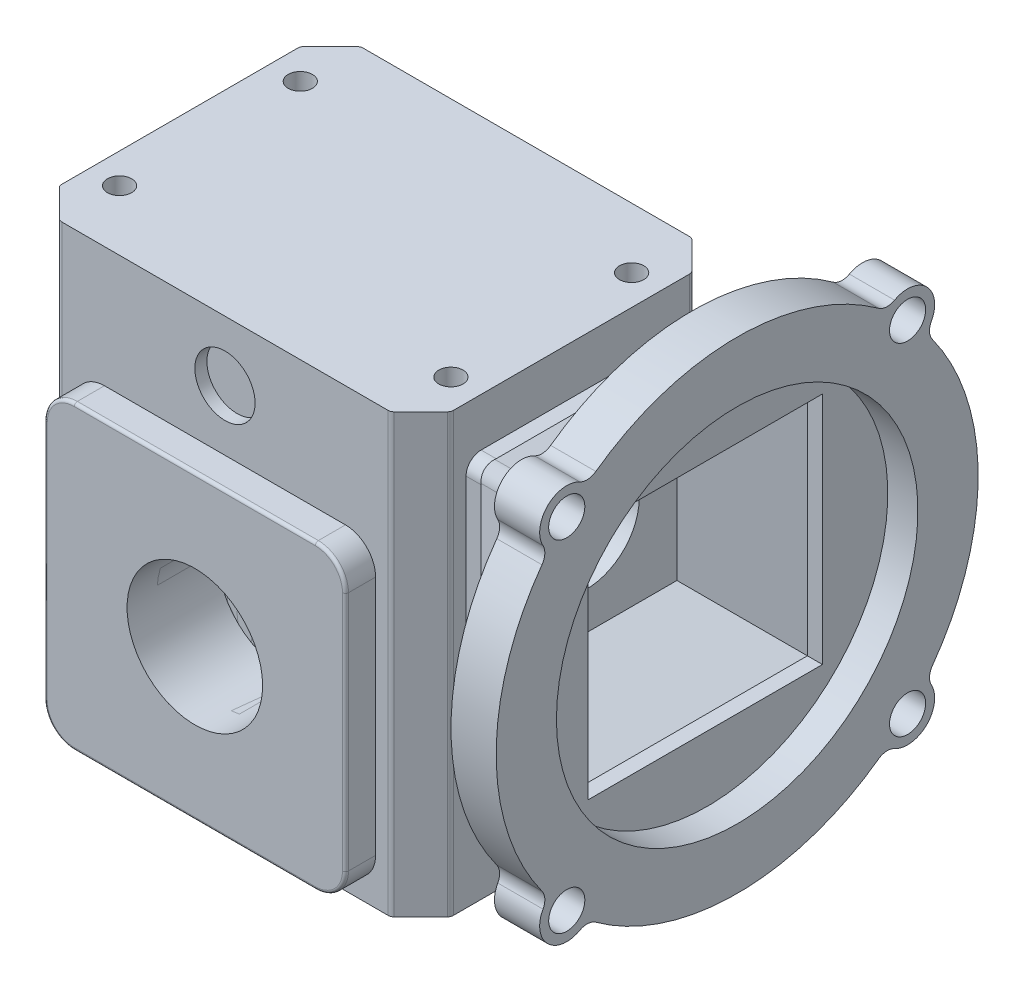
from build123d import *

# Parameters (mm, degrees)
SKETCH1_W                            = 82.55
SKETCH1_H                            = 63.5
BOSS_EXTRUDE1_DEPTH                  = 46.101
CHAMFER1_SIZE                        = 6.35
BOSS_EXTRUDE2_DEPTH                  = 6.35
BOSS_EXTRUDE2_DEPTH_BACK             = 69.85
SKETCH2_W                            = 63.5
SKETCH2_H                            = 63.5
FILLET1_R                            = 6.35
FILLET2_R                            = 0.635
FILLET3_R                            = 1.27
SKETCH3_R                            = 14.2875
CUT_EXTRUDE1_DEPTH                   = 19.05
SKETCH4_W                            = 44.45
SKETCH4_H                            = 44.45
BOSS_EXTRUDE3_DEPTH                  = 3.175
FILLET4_R                            = 3.175
SKETCH7_R                            = 38.1
SKETCH7_W                            = 49.391408666
SKETCH7_H                            = 49.391408666
BOSS_EXTRUDE4_DEPTH                  = 3.175
SKETCH8_R                            = 50.8
SKETCH8_R_2                          = 38.1
BOSS_EXTRUDE5_DEPTH                  = 9.525
SKETCH12_R                           = 5.715
SKETCH12_R_2                         = 3.81
BOSS_EXTRUDE6_DEPTH                  = 9.525
SKETCH13_R                           = 3.81
CUT_EXTRUDE2_DEPTH                   = 9.525
FILLET5_R                            = 3.175
SKETCH14_R                           = 11.1125
CUT_EXTRUDE3_DEPTH                   = 6.35
TAP_DRILL_FOR_1_4_20_TAP1_AT_2_COUNT = 2
TAP_DRILL_FOR_1_4_20_TAP1_AT_2_PITCH = 38.1
TAP_DRILL_FOR_1_4_20_TAP1_AT_3_COUNT = 2
TAP_DRILL_FOR_1_4_20_TAP1_AT_3_PITCH = 69.85
TAP_DRILL_FOR_1_4_20_TAP1_AT_4_COUNT = 2
TAP_DRILL_FOR_1_4_20_TAP1_AT_4_PITCH = 79.565271947
SKETCH18_R                           = 6.35
CUT_EXTRUDE4_DEPTH                   = 2.54
SKETCH19_R                           = 3.175
CUT_EXTRUDE5_DEPTH                   = 12.7


with BuildPart() as part:
    # Sketch1 → Boss-Extrude1 (new, symmetric)
    with BuildSketch(Plane(origin=(0, 0, 0), x_dir=(1, 0, 0), z_dir=(0, 1, 0))):
        Rectangle(SKETCH1_W, SKETCH1_H)
    extrude(amount=BOSS_EXTRUDE1_DEPTH, both=True)

    # Chamfer1
    chamfer1_edges = [part.edges().sort_by_distance(p)[0] for p in [
        (41.275, 0, -31.75),
        (-41.275, 0, -31.75),
        (-41.275, 0, 31.75),
        (41.275, 0, 31.75),
    ]]
    chamfer(chamfer1_edges, length=CHAMFER1_SIZE)

    # Fillet3
    fillet3_edges = [part.edges().sort_by_distance(p)[0] for p in [
        (34.925, 0, 31.75),
        (41.275, 0, 25.4),
        (41.275, 0, -25.4),
        (34.925, 0, -31.75),
        (-34.925, 0, -31.75),
        (-41.275, 0, -25.4),
        (-41.275, 0, 25.4),
        (-34.925, 0, 31.75),
    ]]
    fillet(fillet3_edges, radius=FILLET3_R)


with BuildPart() as body_2:
    # Sketch2 → Boss-Extrude2 (new, two sides: drawn at the far end of the back side and taken through both)
    with BuildSketch(Plane.XY.offset(31.75).offset(-BOSS_EXTRUDE2_DEPTH_BACK)):
        with Locations((0, -11.049)):
            Rectangle(SKETCH2_W, SKETCH2_H)
    extrude(amount=BOSS_EXTRUDE2_DEPTH + BOSS_EXTRUDE2_DEPTH_BACK)

    # Fillet1
    fillet1_edges = [body_2.edges().sort_by_distance(p)[0] for p in [
        (-31.75, -42.799, 0),
        (31.75, -42.799, 0),
        (31.75, 20.701, 0),
        (-31.75, 20.701, 0),
    ]]
    fillet(fillet1_edges, radius=FILLET1_R)

    # Fillet2
    fillet2_edges = [body_2.edges().sort_by_distance(p)[0] for p in [
        (-29.890128061, 18.841128061, -38.1),
        (0, 20.701, -38.1),
        (29.890128061, 18.841128061, -38.1),
        (31.75, -11.049, -38.1),
        (29.890128061, -40.939128061, -38.1),
        (0, -42.799, -38.1),
        (-29.890128061, -40.939128061, -38.1),
        (29.890128061, 18.841128061, 38.1),
        (31.75, -11.049, 38.1),
        (29.890128061, -40.939128061, 38.1),
        (0, -42.799, 38.1),
        (-29.890128061, -40.939128061, 38.1),
        (-31.75, -11.049, 38.1),
        (-29.890128061, 18.841128061, 38.1),
        (-31.75, -11.049, -38.1),
        (0, 20.701, 38.1),
    ]]
    fillet(fillet2_edges, radius=FILLET2_R)


with BuildPart() as cut_extrude1_tool:
    # Sketch3 → Cut-Extrude1 (new body)
    with BuildSketch(Plane.XY.offset(38.1)):
        with Locations((0, -11.049)):
            Circle(SKETCH3_R)
    extrude(amount=-CUT_EXTRUDE1_DEPTH)


with BuildPart() as part_1:
    add(part.part)

    # Cut-Extrude1: cut by cut_extrude1_tool
    add(cut_extrude1_tool.part, mode=Mode.SUBTRACT)

    # Sketch4 → Boss-Extrude3 (add)
    with BuildSketch(Plane(origin=(41.275, 0, 0), x_dir=(0, 0, -1), z_dir=(1, 0, 0))):
        with Locations((0.018051224, 13.716)):
            Rectangle(SKETCH4_W, SKETCH4_H)
    extrude(amount=BOSS_EXTRUDE3_DEPTH)

    # Sweep1: sweep along a path in Sketch6
    with BuildLine(Plane(origin=(44.45, 0, 0), x_dir=(0, 0, -1), z_dir=(1, 0, 0))) as sweep1_path:
        Line((-22.206948776, 35.941), (22.243051224, 35.941))
        Line((22.243051224, 35.941), (22.243051224, -8.509))
        Line((22.243051224, -8.509), (-22.206948776, -8.509))
        Line((-22.206948776, -8.509), (-22.206948776, 35.941))
    # Sketch5 → Sweep1 (sweep)
    with BuildSketch(Plane.XY):
        Polygon((44.45, 35.941), (66.675, 45.466), (66.675, 42.291), (44.45, 32.766), align=None)
    sweep(path=sweep1_path.line, transition=Transition.RIGHT)

    # Fillet4
    fillet4_edges = [part_1.edges().sort_by_distance(p)[0] for p in [
        (42.8625, -8.509, 22.206948776),
    ]]
    fillet(fillet4_edges, radius=FILLET4_R)
    fillet4_2_edges = [part_1.edges().sort_by_distance(p)[0] for p in [
        (42.8625, 35.941, 22.206948776),
    ]]
    fillet(fillet4_2_edges, radius=FILLET4_R)
    fillet4_3_edges = [part_1.edges().sort_by_distance(p)[0] for p in [
        (42.8625, -8.509, -22.243051224),
    ]]
    fillet(fillet4_3_edges, radius=FILLET4_R)
    fillet4_4_edges = [part_1.edges().sort_by_distance(p)[0] for p in [
        (42.8625, 35.941, -22.243051224),
    ]]
    fillet(fillet4_4_edges, radius=FILLET4_R)
    fillet4_5_edges = [part_1.edges().sort_by_distance(p)[0] for p in [
        (54.477574702, -12.806532015, 26.504480791),
    ]]
    fillet(fillet4_5_edges, radius=FILLET4_R)
    fillet4_6_edges = [part_1.edges().sort_by_distance(p)[0] for p in [
        (54.477574702, 40.238532015, 26.504480791),
    ]]
    fillet(fillet4_6_edges, radius=FILLET4_R)
    fillet4_7_edges = [part_1.edges().sort_by_distance(p)[0] for p in [
        (54.477574702, -12.806532015, -26.540583239),
    ]]
    fillet(fillet4_7_edges, radius=FILLET4_R)
    fillet4_8_edges = [part_1.edges().sort_by_distance(p)[0] for p in [
        (54.477574702, 40.238532015, -26.540583239),
    ]]
    fillet(fillet4_8_edges, radius=FILLET4_R)

    # Sketch7 → Boss-Extrude4 (add)
    with BuildSketch(Plane(origin=(66.675, 0, 0), x_dir=(0, 0, -1), z_dir=(1, 0, 0))):
        with Locations((0.018051224, 13.716)):
            Circle(SKETCH7_R)
        with Locations((-0.349703585, 14.083754809)):
            Rectangle(SKETCH7_W, SKETCH7_H, mode=Mode.SUBTRACT)
    extrude(amount=BOSS_EXTRUDE4_DEPTH)

    # Sketch8 → Boss-Extrude5 (add)
    with BuildSketch(Plane(origin=(66.675, 0, 0), x_dir=(0, 0, -1), z_dir=(1, 0, 0))):
        with Locations((0.018051224, 13.716)):
            Circle(SKETCH8_R)
        with Locations((0.018051224, 13.716)):
            Circle(SKETCH8_R_2, mode=Mode.SUBTRACT)
    extrude(amount=BOSS_EXTRUDE5_DEPTH)

    # Sketch12 → Boss-Extrude6 (add)
    # profile 1 of 4: a face of its own
    with BuildSketch(Plane(origin=(76.2, 0, 0), x_dir=(0, 0, -1), z_dir=(1, 0, 0))):
        with Locations((-35.90297326, 49.637024484)):
            Circle(SKETCH12_R)
        with Locations((-35.90297326, 49.637024484)):
            Circle(SKETCH12_R_2, mode=Mode.SUBTRACT)
    # profile 2 of 4: a face of its own
    with BuildSketch(Plane(origin=(76.2, 0, 0), x_dir=(0, 0, -1), z_dir=(1, 0, 0))):
        with Locations((-35.90297326, -22.205024484)):
            Circle(SKETCH12_R)
        with Locations((-35.90297326, -22.205024484)):
            Circle(SKETCH12_R_2, mode=Mode.SUBTRACT)
    # profile 3 of 4: a face of its own
    with BuildSketch(Plane(origin=(76.2, 0, 0), x_dir=(0, 0, -1), z_dir=(1, 0, 0))):
        with Locations((35.939075708, -22.205024484)):
            Circle(SKETCH12_R)
        with Locations((35.939075708, -22.205024484)):
            Circle(SKETCH12_R_2, mode=Mode.SUBTRACT)
    # profile 4 of 4: a face of its own
    with BuildSketch(Plane(origin=(76.2, 0, 0), x_dir=(0, 0, -1), z_dir=(1, 0, 0))):
        with Locations((35.939075708, 49.637024484)):
            Circle(SKETCH12_R)
        with Locations((35.939075708, 49.637024484)):
            Circle(SKETCH12_R_2, mode=Mode.SUBTRACT)
    extrude(amount=-BOSS_EXTRUDE6_DEPTH)

    # Sketch13 → Cut-Extrude2 (cut)
    with BuildSketch(Plane(origin=(76.2, 0, 0), x_dir=(0, 0, -1), z_dir=(1, 0, 0))):
        with Locations((-35.90297326, 49.637024484)):
            Circle(SKETCH13_R)
        with Locations((35.939075708, 49.637024484)):
            Circle(SKETCH13_R)
        with Locations((35.939075708, -22.205024484)):
            Circle(SKETCH13_R)
        with Locations((-35.90297326, -22.205024484)):
            Circle(SKETCH13_R)
    extrude(amount=-CUT_EXTRUDE2_DEPTH, mode=Mode.SUBTRACT)

    # Fillet5
    fillet5_edges = [part_1.edges().sort_by_distance(p)[0] for p in [
        (71.4375, -17.942994732, 39.710377546),
        (71.4375, -26.01242877, 31.640943508),
        (71.4375, -26.01242877, -31.677045957),
        (71.4375, -17.942994732, -39.746479994),
        (71.4375, 45.374994732, -39.746479994),
        (71.4375, 53.44442877, -31.677045957),
        (71.4375, 53.44442877, 31.640943508),
        (71.4375, 45.374994732, 39.710377546),
    ]]
    fillet(fillet5_edges, radius=FILLET5_R)

    # Sketch14 → Cut-Extrude3 (cut)
    with BuildSketch(Plane(origin=(44.45, 0, 0), x_dir=(0, 0, -1), z_dir=(1, 0, 0))):
        with Locations((0.018051224, 13.716)):
            Circle(SKETCH14_R)
    extrude(amount=-CUT_EXTRUDE3_DEPTH, mode=Mode.SUBTRACT)

    # Sketch16 → Tap Drill for 1/4-20 Tap1 (revolve, cut)
    with BuildSketch(Plane(origin=(-34.925, 46.101, -19.05), x_dir=(0, 0, 1), z_dir=(1, 0, 0))):
        Polygon((0, 0), (0, 17.535816902), (2.5527, 16.002), (2.5527, 0), align=None)
    tap_drill_for_1_4_20_tap1 = revolve(axis=Axis((-34.925, 52.451, -19.05), (0, -1, 0)), mode=Mode.SUBTRACT)

    # Tap Drill for 1/4-20 Tap1 at 2: Tap Drill for 1/4-20 Tap1 ×2
    with Locations(*[(0, 0, i * TAP_DRILL_FOR_1_4_20_TAP1_AT_2_PITCH) for i in range(1, TAP_DRILL_FOR_1_4_20_TAP1_AT_2_COUNT)]):
        add(tap_drill_for_1_4_20_tap1, mode=Mode.SUBTRACT)

    # Tap Drill for 1/4-20 Tap1 at 3: Tap Drill for 1/4-20 Tap1 ×2
    with Locations(*[(i * TAP_DRILL_FOR_1_4_20_TAP1_AT_3_PITCH, 0, 0) for i in range(1, TAP_DRILL_FOR_1_4_20_TAP1_AT_3_COUNT)]):
        add(tap_drill_for_1_4_20_tap1, mode=Mode.SUBTRACT)

    # Tap Drill for 1/4-20 Tap1 at 4: Tap Drill for 1/4-20 Tap1 ×2
    with Locations(*[Vector(0.8778955729143846, 0, 0.478852130680573) * (i * TAP_DRILL_FOR_1_4_20_TAP1_AT_4_PITCH) for i in range(1, TAP_DRILL_FOR_1_4_20_TAP1_AT_4_COUNT)]):
        add(tap_drill_for_1_4_20_tap1, mode=Mode.SUBTRACT)

    # Sketch18 → Cut-Extrude4 (cut)
    with BuildSketch(Plane.XY.offset(31.75)):
        with Locations((0, 33.401)):
            Circle(SKETCH18_R)
    extrude(amount=-CUT_EXTRUDE4_DEPTH, mode=Mode.SUBTRACT)

    # Sketch19 → Cut-Extrude5 (cut)
    with BuildSketch(Plane.XZ.offset(46.101)):
        with Locations((-34.925, -19.05)):
            Circle(SKETCH19_R)
        with Locations((34.925, -19.05)):
            Circle(SKETCH19_R)
        with Locations((34.925, 19.05)):
            Circle(SKETCH19_R)
        with Locations((-34.925, 19.05)):
            Circle(SKETCH19_R)
    extrude(amount=-CUT_EXTRUDE5_DEPTH, mode=Mode.SUBTRACT)


with BuildPart() as body_2_1:
    add(body_2.part)

    # Cut-Extrude1: cut by cut_extrude1_tool
    add(cut_extrude1_tool.part, mode=Mode.SUBTRACT)


solid = Compound([part_1.part, body_2_1.part])
